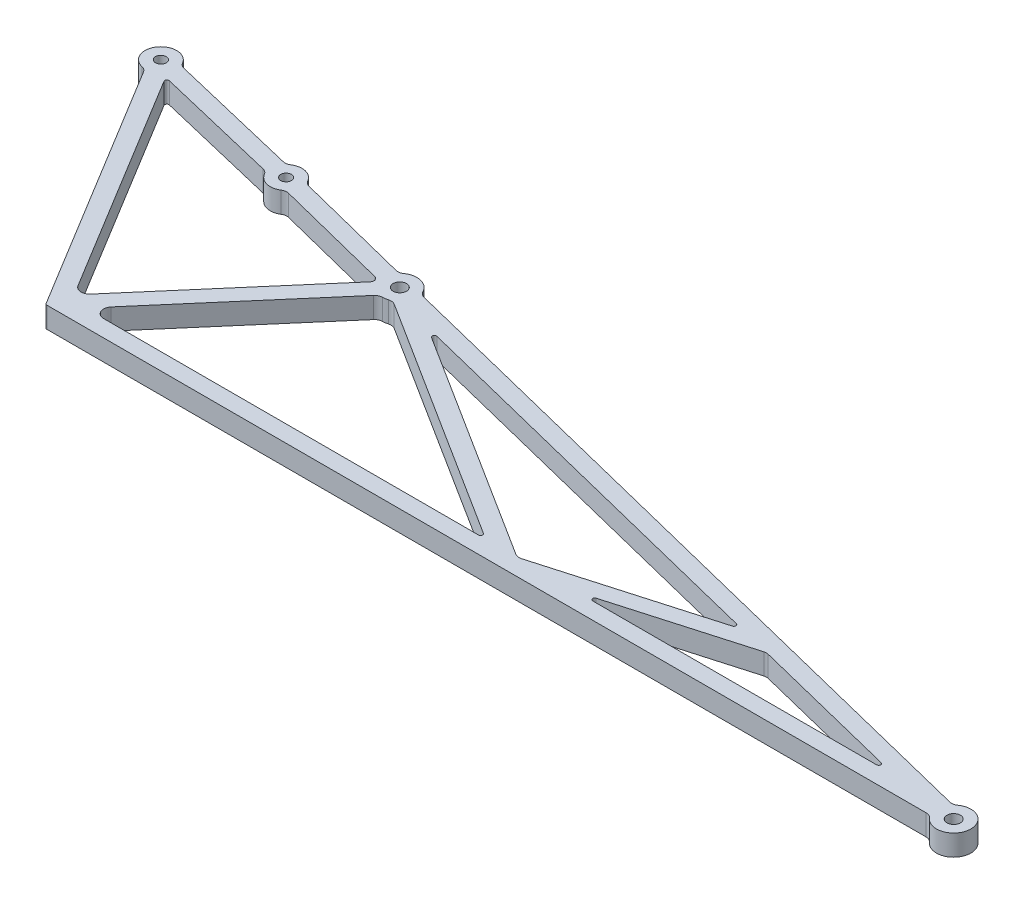
from build123d import *
from build123d.topology import SkipClean

# Parameters (mm, degrees)
SKETCH1_R           = 4.064
SKETCH1_R_2         = 3.2639
BOSS_EXTRUDE1_DEPTH = 6.35
CUT_EXTRUDE1_DEPTH  = 1227.767455485
FILLET1_R           = 5.08
FILLET2_R           = 1.27
FILLET3_R           = 2.54


with BuildPart() as part:
    # Sketch1 → Boss-Extrude1 (new, symmetric)
    with BuildSketch(Plane(origin=(0, 0, 0), x_dir=(1, 0, 0), z_dir=(0, 1, 0))):
        with BuildLine():
            Line((-580.023560274, -1020.213175904), (-32.743203186, -1020.213175904))
            ThreePointArc((-32.743203186, -1020.213175904), (-22.406526942, -1011.065872486), (-30.22862042, -999.693322674))
            Line((-30.22862042, -999.693322674), (-477.113436037, -888.497480987))
            ThreePointArc((-477.113436037, -888.497480987), (-477.140285594, -888.490838013), (-477.1671527, -888.484266374))
            Line((-477.1671527, -888.484266374), (-569.477932839, -866.035116584))
            ThreePointArc((-569.477932839, -866.035116584), (-569.495309073, -866.030907949), (-569.512693103, -866.026731636))
            Line((-569.512693103, -866.026731636), (-669.296750672, -842.152874275))
            ThreePointArc((-669.296750672, -842.152874275), (-679.306252785, -845.844627483), (-679.744367756, -856.504234867))
            Line((-679.744367756, -856.504234867), (-580.023560274, -1020.213175904))
        make_face()
        with Locations(Location((-32.743203186, -1009.799175904, 0), (0, 0, 270))):
            Circle(SKETCH1_R, mode=Mode.SUBTRACT)
        with Locations(Location((-479.628018803, -898.603334218, 0), (0, 0, 270))):
            Circle(SKETCH1_R, mode=Mode.SUBTRACT)
        with Locations(Location((-571.749732399, -875.37674385, 0), (0, 0, 270))):
            Circle(SKETCH1_R_2, mode=Mode.SUBTRACT)
        with Locations(Location((-671.533789968, -851.502886488, 0), (0, 0, 270))):
            Circle(SKETCH1_R_2, mode=Mode.SUBTRACT)
    extrude(amount=BOSS_EXTRUDE1_DEPTH, both=True)

    # Sketch2 → Cut-Extrude1 (cut, through all)
    with SkipClean():  # the faces are left unmerged after this step: merging them gives an invalid solid
        with BuildSketch(Plane(origin=(0, 6.35, 0), x_dir=(1, 0, 0), z_dir=(0, 1, 0))):
            with BuildLine():
                Line((-679.744367756, -856.504234867), (-580.023560274, -1020.213175904))
                Line((-580.023560274, -1020.213175904), (-32.743203186, -1020.213175904))
                ThreePointArc((-32.743203186, -1020.213175904), (-38.013320642, -1018.781227897), (-41.834132511, -1014.879175904))
                Line((-41.834132511, -1014.879175904), (-577.963867352, -1014.879175904))
                Line((-577.963867352, -1014.879175904), (-671.626154715, -861.116342785))
                ThreePointArc((-671.626154715, -861.116342785), (-676.282747595, -859.861981814), (-679.744367756, -856.504234867))
            make_face()
            with BuildLine():
                Line((-569.512693103, -866.026731636), (-669.296750672, -842.152874275))
                ThreePointArc((-669.296750672, -842.152874275), (-665.037914564, -844.415526194), (-662.413625342, -848.461559408))
                Line((-662.413625342, -848.461559408), (-578.505786805, -868.536948379))
                ThreePointArc((-578.505786805, -868.536948379), (-574.334431882, -866.116808548), (-569.512693103, -866.026731636))
            make_face()
            with BuildLine():
                Line((-469.57946129, -895.868761508), (-40.33850922, -1002.674379609))
                ThreePointArc((-40.33850922, -1002.674379609), (-35.688557552, -999.810367984), (-30.22862042, -999.693322674))
                Line((-30.22862042, -999.693322674), (-477.113436037, -888.497480987))
                ThreePointArc((-477.113436037, -888.497480987), (-472.345020276, -891.159589968), (-469.57946129, -895.868761508))
            make_face()
            with BuildLine():
                Line((-477.1671527, -888.484266374), (-569.477932839, -866.035116584))
                ThreePointArc((-569.477932839, -866.035116584), (-565.197857445, -868.341119656), (-562.593315725, -872.446367271))
                Line((-562.593315725, -872.446367271), (-487.201130908, -891.45495195))
                ThreePointArc((-487.201130908, -891.45495195), (-482.584369255, -888.617775245), (-477.1671527, -888.484266374))
            make_face()
            with BuildLine():
                ThreePointArc((-565.077216711, -882.298059303), (-574.043489966, -884.713003777), (-580.869897025, -878.41807093))
                Line((-580.869897025, -878.41807093), (-660.846200897, -859.283322179))
                Line((-660.846200897, -859.283322179), (-574.408981883, -1001.184956836))
                Line((-574.408981883, -1001.184956836), (-489.404527792, -902.190989161))
                ThreePointArc((-489.404527792, -902.190989161), (-489.554632834, -901.751941826), (-489.685031894, -901.306643982))
                Line((-489.685031894, -901.306643982), (-565.077216711, -882.298059303))
            make_face()
            Polygon((-196.508330191, -974.285316963), (-450.342933685, -911.125076565), (-302.454173976, -1004.719175904), align=None)
            with BuildLine():
                Line((-321.452940497, -1004.719175904), (-474.662853281, -907.757487774))
                ThreePointArc((-474.662853281, -907.757487774), (-478.086983606, -908.902684028), (-481.696350414, -908.809871355))
                Line((-481.696350414, -908.809871355), (-564.05205619, -1004.719175904))
                Line((-564.05205619, -1004.719175904), (-321.452940497, -1004.719175904))
            make_face()
            Polygon((-74.197736242, -1004.719175904), (-176.789592181, -979.191819922), (-265.654999436, -1004.719175904), align=None)
        extrude(amount=-CUT_EXTRUDE1_DEPTH, mode=Mode.SUBTRACT)

    # Fillet1
    fillet1_edges = [part.edges().sort_by_distance(p)[0] for p in [
        (-662.413625342, 0, 848.461559408),
        (-578.505786805, 0, 868.536948379),
        (-671.626154715, 0, 861.116342785),
        (-41.834132511, 0, 1014.879175904),
        (-302.454173976, 0, 1004.719175904),
        (-176.789592181, 0, 979.191819922),
        (-580.869897025, 0, 878.41807093),
        (-565.077216711, 0, 882.298059303),
        (-574.408981883, 0, 1001.184956836),
        (-469.57946129, 0, 895.868761508),
        (-40.33850922, 0, 1002.674379609),
        (-481.696350414, 0, 908.809871355),
        (-474.662853281, 0, 907.757487774),
        (-564.05205619, 0, 1004.719175904),
        (-562.593315725, 0, 872.446367271),
        (-487.201130908, 0, 891.45495195),
    ]]
    fillet(fillet1_edges, radius=FILLET1_R)

    # Fillet2
    fillet2_edges = [part.edges().sort_by_distance(p)[0] for p in [
        (-577.963867352, 0, 1014.879175904),
        (-450.342933685, 0, 911.125076565),
        (-196.508330191, 0, 974.285316963),
        (-74.197736242, 0, 1004.719175904),
        (-265.654999436, 0, 1004.719175904),
        (-660.846200897, 0, 859.283322179),
        (-321.452940497, 0, 1004.719175904),
    ]]
    fillet(fillet2_edges, radius=FILLET2_R)

    # Fillet3
    # the kernel refuses this fillet: 2.54 mm, written as the material it adds along each edge
    with BuildSketch(Plane(origin=(-489.685031894, 6.35, 901.306643982), x_dir=(-0.9696547275451901, 0, -0.24447844352675166), z_dir=(0, -1, 0))) as fillet3_piece_1:
        with BuildLine():
            CenterArc((3.223121953, -2.54), FILLET3_R, 90, 116.501118017)
            Line((0.95001079, -3.673386801), (0.722699673, -3.786725481))
            ThreePointArc((0.722699673, -3.786725481), (-0.715506578, -0.902270957), (-0.221729984, 0.123902439))
            Line((-0.221729984, 0.123902439), (0, 0.254))
            Line((0, 0.254), (3.223121953, 0.254))
            Line((3.223121953, 0.254), (3.223121953, 0))
        make_face()
    extrude(amount=12.7)
    with BuildSketch(Plane(origin=(-489.404527792, 6.35, 902.190989161), x_dir=(-0.6514647829655796, 0, 0.7586788757805311), z_dir=(0, -1, 0))) as fillet3_piece_2:
        with BuildLine():
            CenterArc((3.223121953, 2.54), FILLET3_R, 153.498881983, 116.501118017)
            Line((0.95001079, 3.673386801), (0.722699673, 3.786725481))
            ThreePointArc((0.722699673, 3.786725481), (-0.715506578, 0.902270957), (-0.221729984, -0.123902439))
            Line((-0.221729984, -0.123902439), (0, -0.254))
            Line((0, -0.254), (3.223121953, -0.254))
            Line((3.223121953, -0.254), (3.223121953, 0))
        make_face()
    extrude(amount=12.7)


solid = part.part
